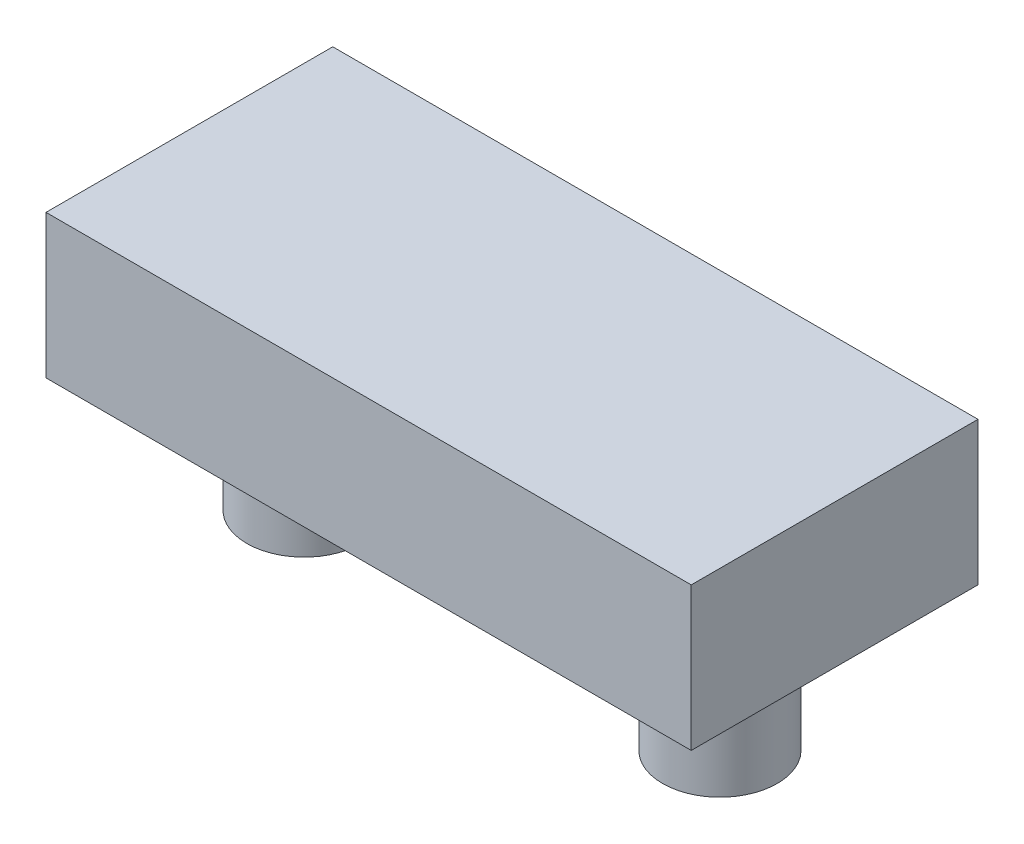
from build123d import *

# Parameters (mm, degrees)
SKETCH1_W           = 450
SKETCH1_H           = 100
BOSS_EXTRUDE1_DEPTH = 200
SKETCH2_R           = 40
BOSS_EXTRUDE2_DEPTH = 90


with BuildPart() as part:
    # Sketch1 → Boss-Extrude1 (new body)
    with BuildSketch(Plane.XY):
        with Locations((225, 590)):
            Rectangle(SKETCH1_W, SKETCH1_H)
    extrude(amount=BOSS_EXTRUDE1_DEPTH)

    # Sketch2 → Boss-Extrude2 (add)
    with BuildSketch(Plane.XZ.offset(-540)):
        with Locations((80, 100)):
            Circle(SKETCH2_R)
        with Locations((370, 100)):
            Circle(SKETCH2_R)
    extrude(amount=BOSS_EXTRUDE2_DEPTH)


solid = part.part
